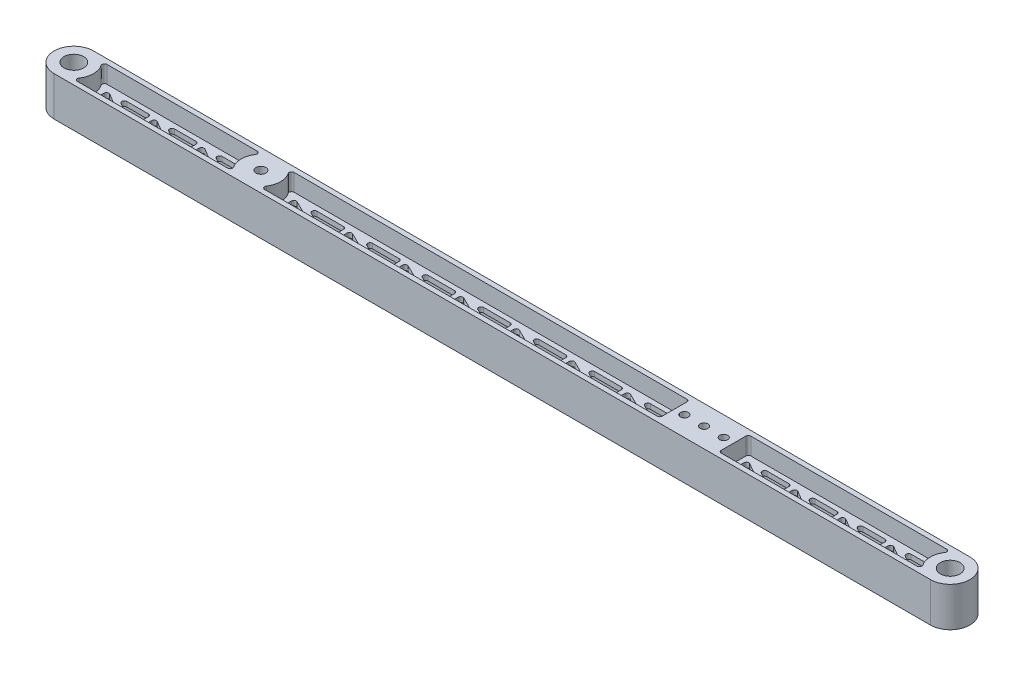
from build123d import *

# Parameters (mm, degrees)
SKETCH2_R                   = 6.35
SKETCH2_R_2                 = 3.175
BOSS_EXTRUDE1_DEPTH         = 25.4
CUT_EXTRUDE2_DEPTH          = 579.965406998
CUT_EXTRUDE3_START          = -11.1125
CUT_EXTRUDE3_DEPTH          = 11.1125
FILLET1_R                   = 1.5875
F_1_4_20_TAPPED_HOLE1_D     = 5.1054
F_1_4_20_TAPPED_HOLE1_DEPTH = 19.05
F_1_4_20_TAPPED_HOLE1_TIP   = 1.533816902


with BuildPart() as part:
    # Sketch2 → Boss-Extrude1 (new body)
    with BuildSketch(Plane(origin=(0, 0, 0), x_dir=(1, 0, 0), z_dir=(0, 1, 0))):
        with BuildLine():
            ThreePointArc((0, 25.4), (-12.7, 12.7), (0, 0))
            Line((0, 0), (565.15, 0))
            ThreePointArc((565.15, 0), (577.85, 12.7), (565.15, 25.4))
            Line((565.15, 25.4), (0, 25.4))
        make_face()
        with Locations((0, 12.7)):
            Circle(SKETCH2_R, mode=Mode.SUBTRACT)
        with Locations((120.65, 12.7)):
            Circle(SKETCH2_R_2, mode=Mode.SUBTRACT)
        with Locations((565.15, 12.7)):
            Circle(SKETCH2_R, mode=Mode.SUBTRACT)
    extrude(amount=BOSS_EXTRUDE1_DEPTH)

    # Sketch13 → Cut-Extrude2 (cut, through all)
    with BuildSketch(Plane(origin=(0, 25.4, 0), x_dir=(1, 0, 0), z_dir=(0, 1, 0))):
        Polygon((37.188969245, 6.35), (15.875, 19.05), (15.875, 6.35), align=None)
        Polygon((43.391666667, 19.05), (22.077697422, 19.05), (43.391666667, 6.35), align=None)
        Polygon((67.880635911, 6.35), (46.566666667, 19.05), (46.566666667, 6.35), align=None)
        Polygon((74.083333333, 19.05), (52.769364089, 19.05), (74.083333333, 6.35), align=None)
        Polygon((98.572302578, 6.35), (77.258333333, 19.05), (77.258333333, 6.35), align=None)
        Polygon((104.775, 19.05), (83.461030755, 19.05), (104.775, 6.35), align=None)
        Polygon((162.053809746, 6.35), (136.525, 19.05), (136.525, 6.35), align=None)
        Polygon((169.182142857, 19.05), (143.653333111, 19.05), (169.182142857, 6.35), align=None)
        Polygon((197.885952603, 6.35), (172.357142857, 19.05), (172.357142857, 6.35), align=None)
        Polygon((205.014285714, 19.05), (179.485475968, 19.05), (205.014285714, 6.35), align=None)
        Polygon((233.71809546, 6.35), (208.189285714, 19.05), (208.189285714, 6.35), align=None)
        Polygon((240.846428571, 19.05), (215.317618825, 19.05), (240.846428571, 6.35), align=None)
        Polygon((269.550238318, 6.35), (244.021428571, 19.05), (244.021428571, 6.35), align=None)
        Polygon((276.678571429, 19.05), (251.149761682, 19.05), (276.678571429, 6.35), align=None)
        Polygon((305.382381175, 6.35), (279.853571429, 19.05), (279.853571429, 6.35), align=None)
        Polygon((312.510714286, 19.05), (286.98190454, 19.05), (312.510714286, 6.35), align=None)
        Polygon((341.214524032, 6.35), (315.685714286, 19.05), (315.685714286, 6.35), align=None)
        Polygon((348.342857143, 19.05), (322.814047397, 19.05), (348.342857143, 6.35), align=None)
        Polygon((377.046666889, 6.35), (351.517857143, 19.05), (351.517857143, 6.35), align=None)
        Polygon((384.175, 19.05), (358.646190254, 19.05), (384.175, 6.35), align=None)
        Polygon((450.156724268, 6.35), (428.625, 19.05), (428.625, 6.35), align=None)
        Polygon((456.40625, 19.05), (434.874525732, 19.05), (456.40625, 6.35), align=None)
        Polygon((481.112974268, 6.35), (459.58125, 19.05), (459.58125, 6.35), align=None)
        Polygon((487.3625, 19.05), (465.830775732, 19.05), (487.3625, 6.35), align=None)
        Polygon((512.069224268, 6.35), (490.5375, 19.05), (490.5375, 6.35), align=None)
        Polygon((518.31875, 19.05), (496.787025732, 19.05), (518.31875, 6.35), align=None)
        Polygon((543.025474268, 6.35), (521.49375, 19.05), (521.49375, 6.35), align=None)
        Polygon((549.275, 19.05), (527.743275732, 19.05), (549.275, 6.35), align=None)
    extrude(amount=-CUT_EXTRUDE2_DEPTH, mode=Mode.SUBTRACT)

    # Sketch13<4> → Cut-Extrude3 (cut)
    # profile 1 of 3: a face of its own
    with BuildSketch(Plane(origin=(0, 25.4, 0), x_dir=(1, 0, 0), z_dir=(0, 1, 0)).offset(CUT_EXTRUDE3_START)):
        with BuildLine():
            ThreePointArc((556.749739587, 3.175), (552.45, 12.7), (556.749739587, 22.225))
            Line((556.749739587, 22.225), (425.45, 22.225))
            Line((425.45, 22.225), (425.45, 3.175))
            Line((425.45, 3.175), (556.749739587, 3.175))
        make_face()
        Polygon((428.625, 6.35), (428.625, 19.05), (450.156724268, 6.35), align=None, mode=Mode.SUBTRACT)
        Polygon((456.40625, 6.35), (434.874525732, 19.05), (456.40625, 19.05), align=None, mode=Mode.SUBTRACT)
        Polygon((459.58125, 6.35), (459.58125, 19.05), (481.112974268, 6.35), align=None, mode=Mode.SUBTRACT)
        Polygon((487.3625, 6.35), (465.830775732, 19.05), (487.3625, 19.05), align=None, mode=Mode.SUBTRACT)
        Polygon((490.5375, 6.35), (490.5375, 19.05), (512.069224268, 6.35), align=None, mode=Mode.SUBTRACT)
        Polygon((518.31875, 6.35), (496.787025732, 19.05), (518.31875, 19.05), align=None, mode=Mode.SUBTRACT)
        Polygon((521.49375, 6.35), (521.49375, 19.05), (543.025474268, 6.35), align=None, mode=Mode.SUBTRACT)
        Polygon((549.275, 6.35), (527.743275732, 19.05), (549.275, 19.05), align=None, mode=Mode.SUBTRACT)
    # profile 2 of 3: a face of its own
    with BuildSketch(Plane(origin=(0, 25.4, 0), x_dir=(1, 0, 0), z_dir=(0, 1, 0)).offset(CUT_EXTRUDE3_START)):
        with BuildLine():
            Line((387.35, 3.175), (387.35, 22.225))
            Line((387.35, 22.225), (129.050260413, 22.225))
            ThreePointArc((129.050260413, 22.225), (133.35, 12.7), (129.050260413, 3.175))
            Line((129.050260413, 3.175), (387.35, 3.175))
        make_face()
        Polygon((136.525, 6.35), (136.525, 19.05), (162.053809746, 6.35), align=None, mode=Mode.SUBTRACT)
        Polygon((169.182142857, 6.35), (143.653333111, 19.05), (169.182142857, 19.05), align=None, mode=Mode.SUBTRACT)
        Polygon((172.357142857, 6.35), (172.357142857, 19.05), (197.885952603, 6.35), align=None, mode=Mode.SUBTRACT)
        Polygon((205.014285714, 6.35), (179.485475968, 19.05), (205.014285714, 19.05), align=None, mode=Mode.SUBTRACT)
        Polygon((208.189285714, 6.35), (208.189285714, 19.05), (233.71809546, 6.35), align=None, mode=Mode.SUBTRACT)
        Polygon((240.846428571, 6.35), (215.317618825, 19.05), (240.846428571, 19.05), align=None, mode=Mode.SUBTRACT)
        Polygon((244.021428571, 6.35), (244.021428571, 19.05), (269.550238318, 6.35), align=None, mode=Mode.SUBTRACT)
        Polygon((276.678571429, 6.35), (251.149761682, 19.05), (276.678571429, 19.05), align=None, mode=Mode.SUBTRACT)
        Polygon((279.853571429, 6.35), (279.853571429, 19.05), (305.382381175, 6.35), align=None, mode=Mode.SUBTRACT)
        Polygon((312.510714286, 6.35), (286.98190454, 19.05), (312.510714286, 19.05), align=None, mode=Mode.SUBTRACT)
        Polygon((315.685714286, 6.35), (315.685714286, 19.05), (341.214524032, 6.35), align=None, mode=Mode.SUBTRACT)
        Polygon((348.342857143, 6.35), (322.814047397, 19.05), (348.342857143, 19.05), align=None, mode=Mode.SUBTRACT)
        Polygon((351.517857143, 6.35), (351.517857143, 19.05), (377.046666889, 6.35), align=None, mode=Mode.SUBTRACT)
        Polygon((384.175, 6.35), (358.646190254, 19.05), (384.175, 19.05), align=None, mode=Mode.SUBTRACT)
    # profile 3 of 3: a face of its own
    with BuildSketch(Plane(origin=(0, 25.4, 0), x_dir=(1, 0, 0), z_dir=(0, 1, 0)).offset(CUT_EXTRUDE3_START)):
        with BuildLine():
            ThreePointArc((112.249739587, 3.175), (107.95, 12.7), (112.249739587, 22.225))
            Line((112.249739587, 22.225), (8.400260413, 22.225))
            ThreePointArc((8.400260413, 22.225), (12.7, 12.7), (8.400260413, 3.175))
            Line((8.400260413, 3.175), (112.249739587, 3.175))
        make_face()
        Polygon((15.875, 6.35), (15.875, 19.05), (37.188969245, 6.35), align=None, mode=Mode.SUBTRACT)
        Polygon((43.391666667, 6.35), (22.077697422, 19.05), (43.391666667, 19.05), align=None, mode=Mode.SUBTRACT)
        Polygon((46.566666667, 6.35), (46.566666667, 19.05), (67.880635911, 6.35), align=None, mode=Mode.SUBTRACT)
        Polygon((74.083333333, 6.35), (52.769364089, 19.05), (74.083333333, 19.05), align=None, mode=Mode.SUBTRACT)
        Polygon((77.258333333, 6.35), (77.258333333, 19.05), (98.572302578, 6.35), align=None, mode=Mode.SUBTRACT)
        Polygon((104.775, 6.35), (83.461030755, 19.05), (104.775, 19.05), align=None, mode=Mode.SUBTRACT)
    cut_extrude3 = extrude(amount=CUT_EXTRUDE3_DEPTH, mode=Mode.SUBTRACT)

    # Mirror1: Cut-Extrude3 across plane
    add(cut_extrude3.mirror(Plane(origin=(0, 12.7, 0), x_dir=(0, 0, 1), z_dir=(0, -1, 0))), mode=Mode.SUBTRACT)

    # Fillet1
    fillet1_edges = [part.edges().sort_by_distance(p)[0] for p in [
        (104.775, 12.7, -19.05),
        (83.461030755, 12.7, -19.05),
        (98.572302578, 12.7, -6.35),
        (77.258333333, 12.7, -6.35),
        (77.258333333, 12.7, -19.05),
        (74.083333333, 12.7, -19.05),
        (74.083333333, 12.7, -6.35),
        (52.769364089, 12.7, -19.05),
        (67.880635911, 12.7, -6.35),
        (46.566666667, 12.7, -6.35),
        (46.566666667, 12.7, -19.05),
        (43.391666667, 12.7, -19.05),
        (43.391666667, 12.7, -6.35),
        (22.077697422, 12.7, -19.05),
        (37.188969245, 12.7, -6.35),
        (15.875, 12.7, -6.35),
        (15.875, 12.7, -19.05),
        (104.775, 12.7, -6.35),
        (384.175, 12.7, -19.05),
        (358.646190254, 12.7, -19.05),
        (377.046666889, 12.7, -6.35),
        (351.517857143, 12.7, -6.35),
        (351.517857143, 12.7, -19.05),
        (348.342857143, 12.7, -19.05),
        (348.342857143, 12.7, -6.35),
        (322.814047397, 12.7, -19.05),
        (341.214524032, 12.7, -6.35),
        (315.685714286, 12.7, -6.35),
        (315.685714286, 12.7, -19.05),
        (312.510714286, 12.7, -19.05),
        (312.510714286, 12.7, -6.35),
        (286.98190454, 12.7, -19.05),
        (305.382381175, 12.7, -6.35),
        (279.853571429, 12.7, -6.35),
        (279.853571429, 12.7, -19.05),
        (276.678571429, 12.7, -19.05),
        (276.678571429, 12.7, -6.35),
        (251.149761682, 12.7, -19.05),
        (269.550238318, 12.7, -6.35),
        (244.021428571, 12.7, -6.35),
        (244.021428571, 12.7, -19.05),
        (240.846428571, 12.7, -19.05),
        (240.846428571, 12.7, -6.35),
        (215.317618825, 12.7, -19.05),
        (233.71809546, 12.7, -6.35),
        (208.189285714, 12.7, -6.35),
        (208.189285714, 12.7, -19.05),
        (205.014285714, 12.7, -19.05),
        (205.014285714, 12.7, -6.35),
        (179.485475968, 12.7, -19.05),
        (197.885952603, 12.7, -6.35),
        (172.357142857, 12.7, -6.35),
        (172.357142857, 12.7, -19.05),
        (169.182142857, 12.7, -19.05),
        (169.182142857, 12.7, -6.35),
        (143.653333111, 12.7, -19.05),
        (162.053809746, 12.7, -6.35),
        (136.525, 12.7, -6.35),
        (136.525, 12.7, -19.05),
        (384.175, 12.7, -6.35),
        (112.249739587, 5.55625, -22.225),
        (112.249739587, 5.55625, -3.175),
        (8.400260413, 5.55625, -3.175),
        (8.400260413, 5.55625, -22.225),
        (387.35, 5.55625, -22.225),
        (129.050260413, 5.55625, -3.175),
        (129.050260413, 5.55625, -22.225),
        (387.35, 5.55625, -3.175),
        (425.45, 19.84375, -22.225),
        (425.45, 19.84375, -3.175),
        (556.749739587, 19.84375, -3.175),
        (112.249739587, 19.84375, -3.175),
        (112.249739587, 19.84375, -22.225),
        (8.400260413, 19.84375, -22.225),
        (8.400260413, 19.84375, -3.175),
        (387.35, 19.84375, -3.175),
        (387.35, 19.84375, -22.225),
        (129.050260413, 19.84375, -22.225),
        (129.050260413, 19.84375, -3.175),
        (556.749739587, 19.84375, -22.225),
        (549.275, 12.7, -6.35),
        (527.743275732, 12.7, -19.05),
        (543.025474268, 12.7, -6.35),
        (521.49375, 12.7, -6.35),
        (521.49375, 12.7, -19.05),
        (518.31875, 12.7, -19.05),
        (518.31875, 12.7, -6.35),
        (496.787025732, 12.7, -19.05),
        (512.069224268, 12.7, -6.35),
        (490.5375, 12.7, -6.35),
        (490.5375, 12.7, -19.05),
        (487.3625, 12.7, -19.05),
        (487.3625, 12.7, -6.35),
        (465.830775732, 12.7, -19.05),
        (481.112974268, 12.7, -6.35),
        (459.58125, 12.7, -6.35),
        (459.58125, 12.7, -19.05),
        (456.40625, 12.7, -19.05),
        (456.40625, 12.7, -6.35),
        (434.874525732, 12.7, -19.05),
        (450.156724268, 12.7, -6.35),
        (428.625, 12.7, -6.35),
        (428.625, 12.7, -19.05),
        (549.275, 12.7, -19.05),
        (556.749739587, 5.55625, -22.225),
        (425.45, 5.55625, -22.225),
        (425.45, 5.55625, -3.175),
        (556.749739587, 5.55625, -3.175),
    ]]
    fillet(fillet1_edges, radius=FILLET1_R)

    # 1/4-20 Tapped Hole1
    with Locations(Plane(origin=(393.7, 25.4, -12.7), x_dir=(0, 0, 1), z_dir=(0, 1, 0))):
        with Locations((0, 0), (0, 12.7), (0, 25.4)):
            Hole(F_1_4_20_TAPPED_HOLE1_D / 2, depth=F_1_4_20_TAPPED_HOLE1_DEPTH)
            with Locations((0, 0, -(F_1_4_20_TAPPED_HOLE1_DEPTH + F_1_4_20_TAPPED_HOLE1_TIP / 2))):  # 118° drill point
                Cone(0, F_1_4_20_TAPPED_HOLE1_D / 2, F_1_4_20_TAPPED_HOLE1_TIP, mode=Mode.SUBTRACT)


solid = part.part
